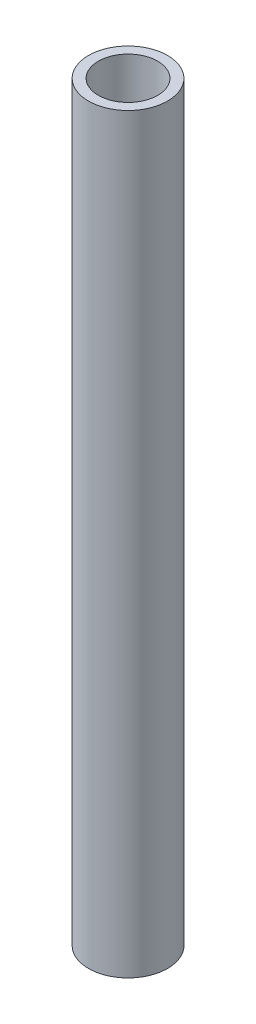
from build123d import *

# Parameters (mm, degrees)
SKETCH1_R           = 12.7
SKETCH1_R_2         = 9.525
BOSS_EXTRUDE2_DEPTH = 241.3


with BuildPart() as part:
    # Sketch1 → Boss-Extrude2 (new body)
    with BuildSketch(Plane(origin=(0, 0, 0), x_dir=(1, 0, 0), z_dir=(0, 1, 0))):
        with Locations((-391.181668083, 212.743279788)):
            Circle(SKETCH1_R)
        with Locations((-391.181668083, 212.743279788)):
            Circle(SKETCH1_R_2, mode=Mode.SUBTRACT)
    extrude(amount=BOSS_EXTRUDE2_DEPTH)


solid = part.part
